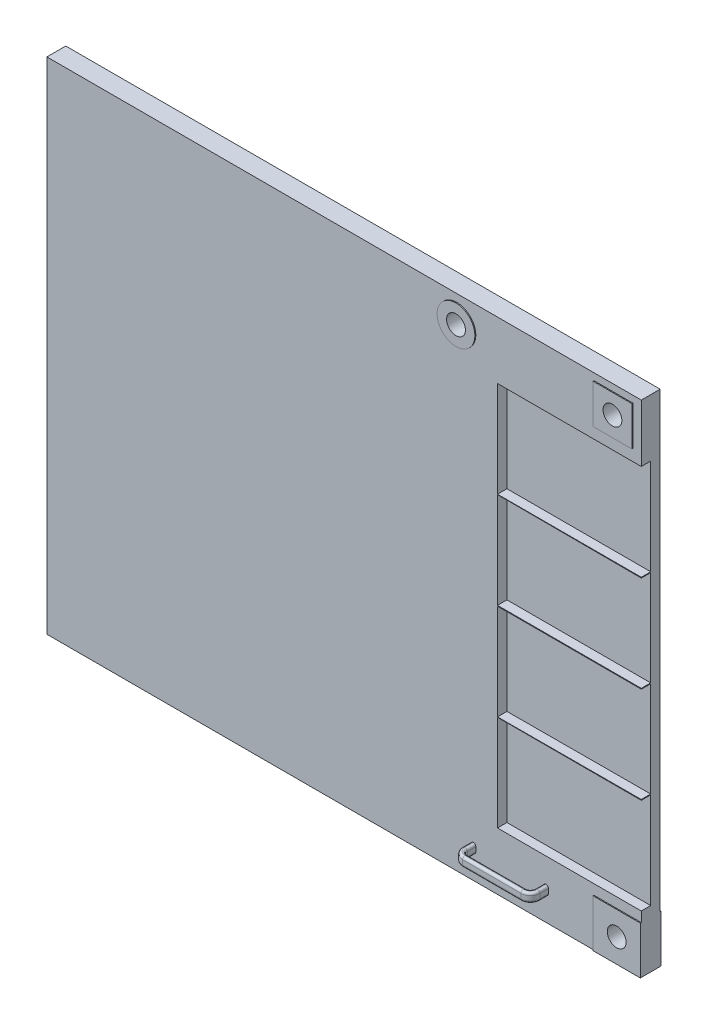
from build123d import *

# Parameters (mm, degrees)
SKETCH1_W                = 63
SKETCH1_H                = 53
BOSS_EXTRUDE1_DEPTH      = 2
SKETCH2_W                = 15.24
SKETCH2_H                = 10.16
CUT_EXTRUDE1_DEPTH       = 1
BOSS_EXTRUDE2_DEPTH      = 0.1
BOSS_EXTRUDE2_DEPTH_BACK = 2.1
SKETCH4_R                = 2
SKETCH4_R_2              = 1
SKETCH4_W                = 5.013644296
SKETCH4_H                = 5.037668264
SKETCH4_W_2              = 4.110148076
SKETCH4_H_2              = 4.160405132
CUT_EXTRUDE2_START       = -2
SKETCH5_R                = 1
CUT_EXTRUDE2_DEPTH       = 2
EXTRUDE_THIN1_DEPTH      = 0.5
EXTRUDE_THIN1_DEPTH_BACK = 0.5
FILLET1_R                = 0.25


with BuildPart() as part:
    # Sketch1 → Boss-Extrude1 (new body)
    with BuildSketch(Plane.XY):
        with Locations((31.5, 26.5)):
            Rectangle(SKETCH1_W, SKETCH1_H)
    extrude(amount=-BOSS_EXTRUDE1_DEPTH)

    # Sketch2 → Cut-Extrude1 (cut)
    with BuildSketch(Plane.XY):
        Polygon((63, 26.54), (47.76, 26.54), (47.76, 36.7), (63, 36.66), align=None)
        with Locations((55.38, 41.82)):
            Rectangle(SKETCH2_W, SKETCH2_H)
        with Locations((55.38, 11.18)):
            Rectangle(SKETCH2_W, SKETCH2_H)
        Polygon((47.76, 16.3), (63, 16.34), (63, 26.46), (47.76, 26.46), align=None)
    extrude(amount=-CUT_EXTRUDE1_DEPTH, mode=Mode.SUBTRACT)

    # Sketch4 → Boss-Extrude2 (add, two sides: drawn at the far end of the back side and taken through both)
    # profile 1 of 3: a face of its own
    with BuildSketch(Plane.XY.offset(-BOSS_EXTRUDE2_DEPTH_BACK)):
        with Locations(Location((43.460589495, 50.19467241, 0), (0, 0, 180))):
            Circle(SKETCH4_R)
        with Locations(Location((43.460589495, 50.19467241, 0), (0, 0, 180))):
            Circle(SKETCH4_R_2, mode=Mode.SUBTRACT)
    # profile 2 of 3: a face of its own
    with BuildSketch(Plane.XY.offset(-BOSS_EXTRUDE2_DEPTH_BACK)):
        with Locations((60.493177852, 2.518834132)):
            Rectangle(SKETCH4_W, SKETCH4_H)
        with Locations(Location((60.493177852, 2.518834132, 0), (0, 0, 180))):
            Circle(SKETCH4_R_2, mode=Mode.SUBTRACT)
    # profile 3 of 3: a face of its own
    with BuildSketch(Plane.XY.offset(-BOSS_EXTRUDE2_DEPTH_BACK)):
        with Locations((60.041429742, 50.19467241)):
            Rectangle(SKETCH4_W_2, SKETCH4_H_2)
        with Locations(Location((60.041429742, 50.19467241, 0), (0, 0, 180))):
            Circle(SKETCH4_R_2, mode=Mode.SUBTRACT)
    extrude(amount=BOSS_EXTRUDE2_DEPTH + BOSS_EXTRUDE2_DEPTH_BACK)

    # Sketch5 → Cut-Extrude2 (cut)
    with BuildSketch(Plane.XY.offset(CUT_EXTRUDE2_START)):
        with Locations((60.493177852, 2.518834132)):
            Circle(SKETCH5_R)
        with Locations((60.041429742, 50.19467241)):
            Circle(SKETCH5_R)
        with Locations((43.460589495, 50.19467241)):
            Circle(SKETCH5_R)
    extrude(amount=CUT_EXTRUDE2_DEPTH, mode=Mode.SUBTRACT)

    # Sketch6 → Extrude-Thin1 (add, two sides: drawn at the far end of the back side and taken through both)
    with BuildSketch(Plane(origin=(0, 3, 0), x_dir=(-1, 0, 0), z_dir=(0, -1, 0)).offset(-EXTRUDE_THIN1_DEPTH_BACK)):
        with BuildLine():
            Line((-45.458769881, 0.670572303), (-45.458769881, -0.900340835))
            ThreePointArc((-45.458769881, -0.900340835), (-45.605216491, -1.253894226), (-45.958769881, -1.400340835))
            Line((-45.958769881, -1.400340835), (-52.153437165, -1.400340835))
            ThreePointArc((-52.153437165, -1.400340835), (-52.506990556, -1.253894226), (-52.653437165, -0.900340835))
            Line((-52.653437165, -0.900340835), (-52.653437165, 0.670572303))
            Line((-52.653437165, 0.670572303), (-53.153437165, 0.670572303))
            Line((-53.153437165, 0.670572303), (-53.153437165, -0.900340835))
            ThreePointArc((-53.153437165, -0.900340835), (-52.860543946, -1.607447616), (-52.153437165, -1.900340835))
            Line((-52.153437165, -1.900340835), (-45.958769881, -1.900340835))
            ThreePointArc((-45.958769881, -1.900340835), (-45.2516631, -1.607447616), (-44.958769881, -0.900340835))
            Line((-44.958769881, -0.900340835), (-44.958769881, 0.670572303))
            Line((-44.958769881, 0.670572303), (-45.458769881, 0.670572303))
        make_face()
    extrude(amount=EXTRUDE_THIN1_DEPTH + EXTRUDE_THIN1_DEPTH_BACK)

    # Fillet1
    fillet1_edges = [part.edges().sort_by_distance(p)[0] for p in [
        (45.458769881, 3.5, 0.450170417),
        (45.605216491, 3.5, 1.253894226),
        (52.653437165, 3.5, 0.450170417),
        (52.506990556, 3.5, 1.253894226),
        (45.458769881, 2.5, 0.450170417),
        (45.605216491, 2.5, 1.253894226),
        (52.653437165, 2.5, 0.450170417),
        (52.506990556, 2.5, 1.253894226),
        (44.958769881, 3.5, 0.450170417),
        (45.2516631, 3.5, 1.607447616),
        (53.153437165, 3.5, 0.450170417),
        (52.860543946, 3.5, 1.607447616),
        (44.958769881, 2.5, 0.450170417),
        (53.153437165, 2.5, 0.450170417),
        (52.860543946, 2.5, 1.607447616),
        (49.056103523, 2.5, 1.900340835),
        (49.056103523, 3.5, 1.400340835),
        (49.056103523, 2.5, 1.400340835),
        (49.056103523, 3.5, 1.900340835),
        (45.2516631, 2.5, 1.607447616),
    ]]
    fillet(fillet1_edges, radius=FILLET1_R - 0.0001)  # a hair under: the kernel refuses the full size


solid = part.part
